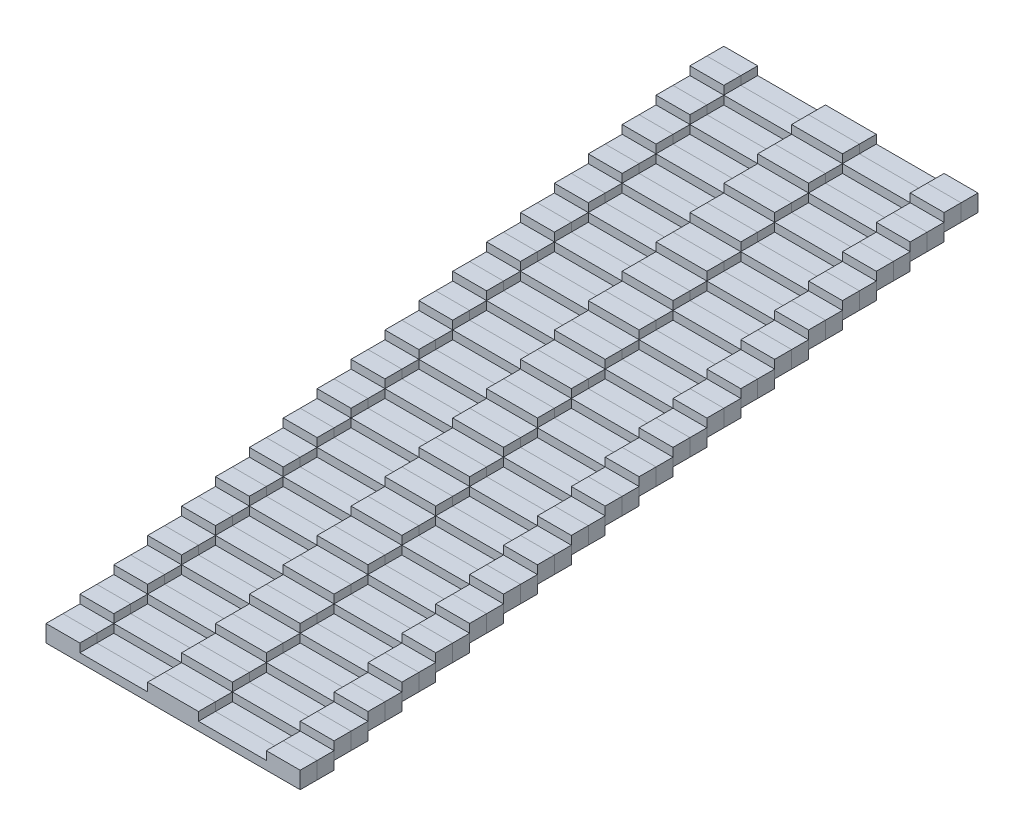
from build123d import *

# Parameters (mm, degrees)
AUFSATZ_LINEAR_AUSTRAGEN1_DEPTH = 1


with BuildPart() as part:
    # Skizze1 → Aufsatz-Linear austragen1 (new body)
    with BuildSketch(Plane.XY):
        Polygon((-1.5, 0), (-1.5, 0.5), (1.5, 0.5), (1.5, 0), (5.5, 0), (5.5, 0.5), (7.5, 0.5), (7.5, -0.5), (-7.5, -0.5), (-7.5, 0.5), (-5.5, 0.5), (-5.5, 0), align=None)
    extrude(amount=AUFSATZ_LINEAR_AUSTRAGEN1_DEPTH)


with BuildPart() as body_2:
    # TMuster1: read off the stored shape, not the designer's step
    # TMuster1: copy of part
    add(part.part.moved(Location((0, -9.5, 39))))


with BuildPart() as body_3:
    # TMuster1 2: copy of part
    add(part.part.moved(Location((0, -9.5, 38))))


with BuildPart() as body_4:
    # TMuster1 3: copy of part
    add(part.part.moved(Location((0, -9, 37))))


with BuildPart() as body_5:
    # TMuster1 4: copy of part
    add(part.part.moved(Location((0, -9, 36))))


with BuildPart() as body_6:
    # TMuster1 5: copy of part
    add(part.part.moved(Location((0, -8.5, 35))))


with BuildPart() as body_7:
    # TMuster1 6: copy of part
    add(part.part.moved(Location((0, -8.5, 34))))


with BuildPart() as body_8:
    # TMuster1 7: copy of part
    add(part.part.moved(Location((0, -8, 33))))


with BuildPart() as body_9:
    # TMuster1 8: copy of part
    add(part.part.moved(Location((0, -8, 32))))


with BuildPart() as body_10:
    # TMuster1 9: copy of part
    add(part.part.moved(Location((0, -7.5, 31))))


with BuildPart() as body_11:
    # TMuster1 10: copy of part
    add(part.part.moved(Location((0, -7.5, 30))))


with BuildPart() as body_12:
    # TMuster1 11: copy of part
    add(part.part.moved(Location((0, -7, 29))))


with BuildPart() as body_13:
    # TMuster1 12: copy of part
    add(part.part.moved(Location((0, -7, 28))))


with BuildPart() as body_14:
    # TMuster1 13: copy of part
    add(part.part.moved(Location((0, -6.5, 27))))


with BuildPart() as body_15:
    # TMuster1 14: copy of part
    add(part.part.moved(Location((0, -6.5, 26))))


with BuildPart() as body_16:
    # TMuster1 15: copy of part
    add(part.part.moved(Location((0, -6, 25))))


with BuildPart() as body_17:
    # TMuster1 16: copy of part
    add(part.part.moved(Location((0, -6, 24))))


with BuildPart() as body_18:
    # TMuster1 17: copy of part
    add(part.part.moved(Location((0, -5.5, 23))))


with BuildPart() as body_19:
    # TMuster1 18: copy of part
    add(part.part.moved(Location((0, -5.5, 22))))


with BuildPart() as body_20:
    # TMuster1 19: copy of part
    add(part.part.moved(Location((0, -5, 21))))


with BuildPart() as body_21:
    # TMuster1 20: copy of part
    add(part.part.moved(Location((0, -5, 20))))


with BuildPart() as body_22:
    # TMuster1 21: copy of part
    add(part.part.moved(Location((0, -4.5, 19))))


with BuildPart() as body_23:
    # TMuster1 22: copy of part
    add(part.part.moved(Location((0, -4.5, 18))))


with BuildPart() as body_24:
    # TMuster1 23: copy of part
    add(part.part.moved(Location((0, -4, 17))))


with BuildPart() as body_25:
    # TMuster1 24: copy of part
    add(part.part.moved(Location((0, -4, 16))))


with BuildPart() as body_26:
    # TMuster1 25: copy of part
    add(part.part.moved(Location((0, -3.5, 15))))


with BuildPart() as body_27:
    # TMuster1 26: copy of part
    add(part.part.moved(Location((0, -3.5, 14))))


with BuildPart() as body_28:
    # TMuster1 27: copy of part
    add(part.part.moved(Location((0, -3, 13))))


with BuildPart() as body_29:
    # TMuster1 28: copy of part
    add(part.part.moved(Location((0, -3, 12))))


with BuildPart() as body_30:
    # TMuster1 29: copy of part
    add(part.part.moved(Location((0, -2.5, 11))))


with BuildPart() as body_31:
    # TMuster1 30: copy of part
    add(part.part.moved(Location((0, -2.5, 10))))


with BuildPart() as body_32:
    # TMuster1 31: copy of part
    add(part.part.moved(Location((0, -2, 9))))


with BuildPart() as body_33:
    # TMuster1 32: copy of part
    add(part.part.moved(Location((0, -2, 8))))


with BuildPart() as body_34:
    # TMuster1 33: copy of part
    add(part.part.moved(Location((0, -1.5, 7))))


with BuildPart() as body_35:
    # TMuster1 34: copy of part
    add(part.part.moved(Location((0, -1.5, 6))))


with BuildPart() as body_36:
    # TMuster1 35: copy of part
    add(part.part.moved(Location((0, -1, 5))))


with BuildPart() as body_37:
    # TMuster1 36: copy of part
    add(part.part.moved(Location((0, -1, 4))))


with BuildPart() as body_38:
    # TMuster1 37: copy of part
    add(part.part.moved(Location((0, -0.5, 3))))


with BuildPart() as body_39:
    # TMuster1 38: copy of part
    add(part.part.moved(Location((0, -0.5, 2))))


with BuildPart() as body_40:
    # TMuster1 39: copy of part
    add(part.part.moved(Location((0, 0, 1))))


solid = Compound([part.part, body_2.part, body_3.part, body_4.part, body_5.part, body_6.part, body_7.part, body_8.part, body_9.part, body_10.part, body_11.part, body_12.part, body_13.part, body_14.part, body_15.part, body_16.part, body_17.part, body_18.part, body_19.part, body_20.part, body_21.part, body_22.part, body_23.part, body_24.part, body_25.part, body_26.part, body_27.part, body_28.part, body_29.part, body_30.part, body_31.part, body_32.part, body_33.part, body_34.part, body_35.part, body_36.part, body_37.part, body_38.part, body_39.part, body_40.part])
